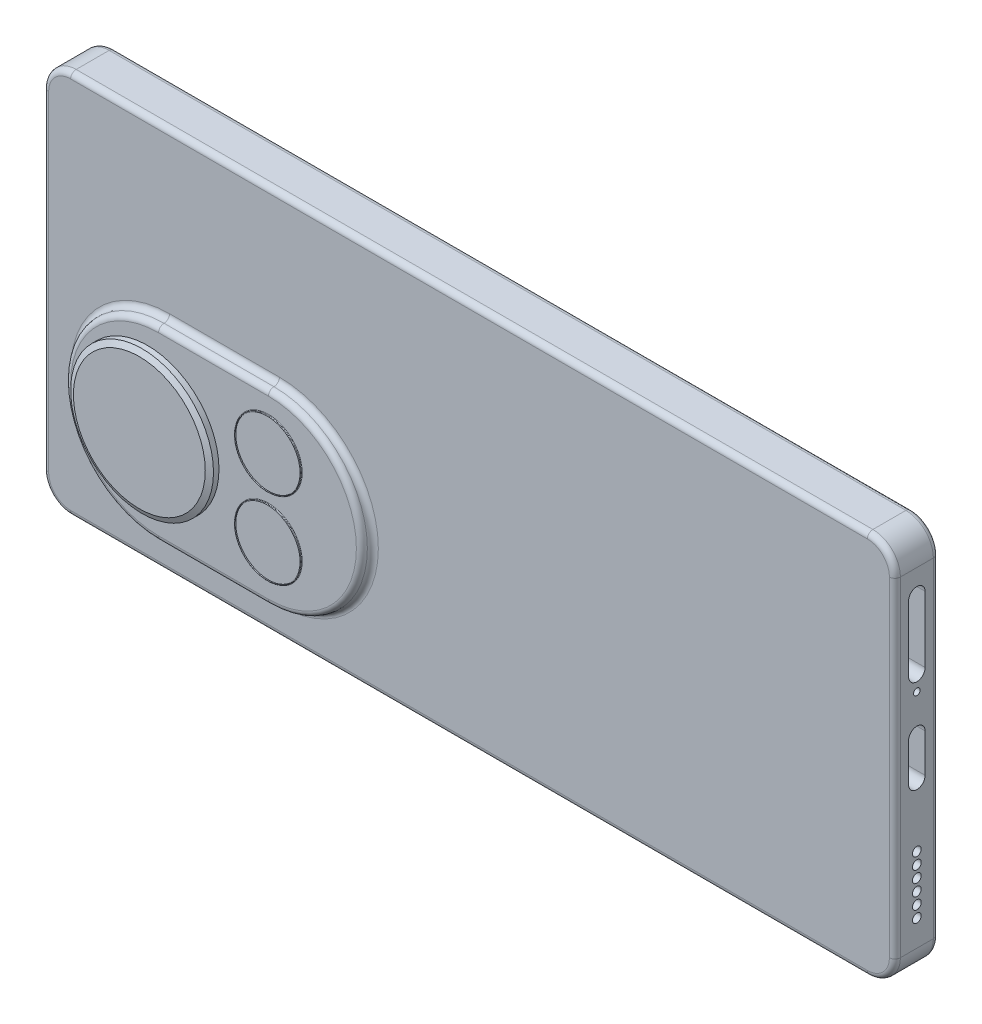
from build123d import *

# Parameters (mm, degrees)
EXTRUDE_1_DEPTH      = 8
FILLET_1_R           = 1
FILLET_2_R           = 1
CUT_EXTRUDE_2_DEPTH  = 7
EXTRUDE_3_DEPTH      = 4
CUT_EXTRUDE_3_DEPTH  = 15
SKETCH_8_R           = 0.6
CUT_EXTRUDE_5_DEPTH  = 10
SKETCH_10_R          = 0.95
CUT_EXTRUDE_6_DEPTH  = 10
SKETCH_11_R          = 0.85
CUT_EXTRUDE_7_DEPTH  = 10
SKETCH_12_R          = 0.95
SKETCH_12_R_2        = 0.9
EXTRUDE_4_DEPTH      = 10
EXTRUDE_START        = 10
SKETCH_13_R          = 0.85
EXTRUDE_5_DEPTH      = 10
SKETCH_14_R          = 0.9
CUT_EXTRUDE_8_DEPTH  = 10
SKETCH_15_R          = 0.9
SKETCH_15_R_2        = 0.8
EXTRUDE_6_DEPTH      = 10
SKETCH_16_R          = 0.9
SKETCH_16_R_2        = 0.8
EXTRUDE_7_DEPTH      = 10
SKETCH_17_R          = 0.8
EXTRUDE_8_DEPTH      = 10
SKETCH_18_R          = 0.8
EXTRUDE_9_DEPTH      = 10
SKETCH_19_R          = 0.8
CUT_EXTRUDE_9_DEPTH  = 10
SKETCH_20_R          = 0.8
CUT_EXTRUDE_10_DEPTH = 10
SKETCH_21_R          = 0.8
CUT_EXTRUDE_11_DEPTH = 10
SKETCH_22_R          = 0.8
CUT_EXTRUDE_12_DEPTH = 10
SKETCH_23_R          = 0.8
CUT_EXTRUDE_13_DEPTH = 10
SKETCH_24_R          = 0.8
CUT_EXTRUDE_14_DEPTH = 10
CUT_EXTRUDE_15_DEPTH = 1
CUT_EXTRUDE_16_DEPTH = 1
CUT_EXTRUDE_17_DEPTH = 128
CUT_EXTRUDE_18_DEPTH = 128
EXTRUDE_10_DEPTH     = 69
EXTRUDE_12_DEPTH     = 69
SKETCH_34_R          = 0.8
CUT_EXTRUDE_19_DEPTH = 190
EXTRUDE_START_2      = -10
SKETCH_37_R          = 0.8
SKETCH_37_R_2        = 0.6
EXTRUDE_13_DEPTH     = 10
EXTRUDE_START_3      = 135
SKETCH_39_R          = 0.8
EXTRUDE_14_DEPTH     = 135
SKETCH_40_R          = 0.6
CUT_EXTRUDE_20_DEPTH = 155
SKETCH_43_R          = 0.6
EXTRUDE_15_DEPTH     = 145
SKETCH_44_R          = 0.6
CUT_EXTRUDE_21_DEPTH = 10
SKETCH_45_R          = 0.6
CUT_EXTRUDE_22_DEPTH = 10
SKETCH_47_R          = 1
EXTRUDE_16_DEPTH     = 10
CUT_EXTRUDE_START    = -10
SKETCH_49_R          = 1
CUT_EXTRUDE_23_DEPTH = 10
SKETCH_50_R          = 1
EXTRUDE_17_DEPTH     = 10
EXTRUDE_18_DEPTH     = 2
FILLET_3_R           = 1
FILLET_4_R           = 1
SKETCH_54_R          = 13
EXTRUDE_19_DEPTH     = 1
SKETCH_55_R          = 12
EXTRUDE_20_DEPTH     = 0.5
SKETCH_56_R          = 1
CUT_EXTRUDE_24_DEPTH = 10
SKETCH_57_R          = 6.05
SKETCH_57_R_2        = 5.95
EXTRUDE_21_DEPTH     = 0.2
FILLET_6_R           = 0.1
SKETCH_58_R          = 6.05
SKETCH_58_R_2        = 5.95
EXTRUDE_22_DEPTH     = 0.2
FILLET_9_R           = 0.1
SKETCH_61_R          = 0.6
EXTRUDE_23_DEPTH     = 10
SKETCH_62_R          = 0.6
EXTRUDE_24_DEPTH     = 10
EXTRUDE_START_4      = -20
SKETCH_65_R          = 0.6
EXTRUDE_28_DEPTH     = 20
SKETCH_67_R          = 0.6
CUT_EXTRUDE_26_DEPTH = 10
SKETCH_68_R          = 0.6
CUT_EXTRUDE_27_DEPTH = 10
SKETCH_69_R          = 0.6
CUT_EXTRUDE_28_DEPTH = 10


with BuildPart() as part:
    # 草图1 → 凸台-拉伸1 (new body)
    with BuildSketch(Plane.XY):
        with BuildLine():
            Line((-74.7920434, 32.978558835), (-74.7920434, -27.021441165))
            ThreePointArc((-74.7920434, -27.021441165), (-73.327577306, -30.556975071), (-69.7920434, -32.021441165))
            Line((-69.7920434, -32.021441165), (75.2079566, -32.021441165))
            ThreePointArc((75.2079566, -32.021441165), (78.743490506, -30.556975071), (80.2079566, -27.021441165))
            Line((80.2079566, -27.021441165), (80.2079566, 32.978558835))
            ThreePointArc((80.2079566, 32.978558835), (78.743490506, 36.514092741), (75.2079566, 37.978558835))
            Line((75.2079566, 37.978558835), (-69.7920434, 37.978558835))
            ThreePointArc((-69.7920434, 37.978558835), (-73.327577306, 36.514092741), (-74.7920434, 32.978558835))
        make_face()
    extrude(amount=EXTRUDE_1_DEPTH)

    # 圆角1
    fillet_1_edges = [part.edges().sort_by_distance(p)[0] for p in [
        (-73.327577306, -30.556975071, 8),
        (2.7079566, -32.021441165, 8),
        (78.743490506, -30.556975071, 8),
        (80.2079566, 2.978558835, 8),
        (78.743490506, 36.514092741, 8),
        (2.7079566, 37.978558835, 8),
        (-73.327577306, 36.514092741, 8),
        (-74.7920434, 2.978558835, 8),
    ]]
    fillet(fillet_1_edges, radius=FILLET_1_R)

    # 圆角2
    fillet_2_edges = [part.edges().sort_by_distance(p)[0] for p in [
        (2.7079566, -32.021441165, 0),
        (-73.327577306, -30.556975071, 0),
        (-74.7920434, 2.978558835, 0),
        (-73.327577306, 36.514092741, 0),
        (2.7079566, 37.978558835, 0),
        (78.743490506, 36.514092741, 0),
        (80.2079566, 2.978558835, 0),
        (78.743490506, -30.556975071, 0),
    ]]
    fillet(fillet_2_edges, radius=FILLET_2_R)

    # 草图3 → 切除-拉伸2 (cut)
    with BuildSketch(Plane(origin=(80.2079566, 0, 0), x_dir=(0, 0, -1), z_dir=(1, 0, 0))):
        with BuildLine():
            Line((-5.5, -0.521441165), (-5.5, 6.478558835))
            ThreePointArc((-5.5, 6.478558835), (-4, 7.978558835), (-2.5, 6.478558835))
            Line((-2.5, 6.478558835), (-2.5, -0.521441165))
            ThreePointArc((-2.5, -0.521441165), (-4, -2.021441165), (-5.5, -0.521441165))
        make_face()
    extrude(amount=-CUT_EXTRUDE_2_DEPTH, mode=Mode.SUBTRACT)

    # 草图6 → 凸台-拉伸3 (add)
    with BuildSketch(Plane(origin=(73.2079566, 0, 0), x_dir=(0, 0, -1), z_dir=(1, 0, 0))):
        with BuildLine():
            Line((-4.1, 0.478558835), (-4.1, 5.478558835))
            ThreePointArc((-4.1, 5.478558835), (-4, 5.578558835), (-3.9, 5.478558835))
            Line((-3.9, 5.478558835), (-3.9, 0.478558835))
            ThreePointArc((-3.9, 0.478558835), (-4, 0.378558835), (-4.1, 0.478558835))
        make_face()
    extrude(amount=EXTRUDE_3_DEPTH)

    # 草图7 → 切除-拉伸3 (cut)
    with BuildSketch(Plane(origin=(80.2079566, 0, 0), x_dir=(0, 0, -1), z_dir=(1, 0, 0))):
        with BuildLine():
            Line((-5.5, 28.478558835), (-5.5, 16.478558835))
            ThreePointArc((-5.5, 16.478558835), (-4, 14.978558835), (-2.5, 16.478558835))
            Line((-2.5, 16.478558835), (-2.5, 28.478558835))
            ThreePointArc((-2.5, 28.478558835), (-4, 29.978558835), (-5.5, 28.478558835))
        make_face()
    extrude(amount=-CUT_EXTRUDE_3_DEPTH, mode=Mode.SUBTRACT)

    # 草图8 → 切除-拉伸5 (cut)
    with BuildSketch(Plane(origin=(80.2079566, 0, 0), x_dir=(0, 0, -1), z_dir=(1, 0, 0))):
        with Locations(Location((-4, 13.378558835, 0), (0, 0, 90))):
            Circle(SKETCH_8_R)
    extrude(amount=-CUT_EXTRUDE_5_DEPTH, mode=Mode.SUBTRACT)

    # 草图10 → 切除-拉伸6 (cut)
    with BuildSketch(Plane(origin=(80.2079566, 0, 0), x_dir=(0, 0, -1), z_dir=(1, 0, 0))):
        with Locations(Location((-4, -11.971441165, 0), (0, 0, 90))):
            Circle(SKETCH_10_R)
    extrude(amount=-CUT_EXTRUDE_6_DEPTH, mode=Mode.SUBTRACT)

    # 草图11 → 切除-拉伸7 (cut)
    with BuildSketch(Plane(origin=(80.2079566, 0, 0), x_dir=(0, 0, -1), z_dir=(1, 0, 0))):
        with Locations(Location((-4, -13.891441165, 0), (0, 0, 90))):
            Circle(SKETCH_11_R)
    extrude(amount=-CUT_EXTRUDE_7_DEPTH, mode=Mode.SUBTRACT)

    # 草图12 → 凸台-拉伸4 (add)
    with BuildSketch(Plane(origin=(80.2079566, 0, 0), x_dir=(0, 0, -1), z_dir=(1, 0, 0))):
        with Locations((-4, -11.971441165)):
            Circle(SKETCH_12_R)
        with Locations(Location((-4, -11.971441165, 0), (0, 0, 90))):
            Circle(SKETCH_12_R_2, mode=Mode.SUBTRACT)
    extrude(amount=-EXTRUDE_4_DEPTH)

    # 草图13 → 凸台-拉伸5 (add)
    with BuildSketch(Plane(origin=(70.2079566, 0, 0), x_dir=(0, 0, -1), z_dir=(1, 0, 0)).offset(EXTRUDE_START)):
        with Locations((-4, -13.891441165)):
            Circle(SKETCH_13_R)
    extrude(amount=-EXTRUDE_5_DEPTH)

    # 草图14 → 切除-拉伸8 (cut)
    with BuildSketch(Plane(origin=(80.2079566, 0, 0), x_dir=(0, 0, -1), z_dir=(1, 0, 0))):
        with Locations(Location((-4, -13.991441165, 0), (0, 0, 90))):
            Circle(SKETCH_14_R)
    extrude(amount=-CUT_EXTRUDE_8_DEPTH, mode=Mode.SUBTRACT)

    # 草图15 → 凸台-拉伸6 (add)
    with BuildSketch(Plane(origin=(80.2079566, 0, 0), x_dir=(0, 0, -1), z_dir=(1, 0, 0))):
        with Locations((-4, -11.971441165)):
            Circle(SKETCH_15_R)
        with Locations(Location((-4, -11.971441165, 0), (0, 0, 90))):
            Circle(SKETCH_15_R_2, mode=Mode.SUBTRACT)
    extrude(amount=-EXTRUDE_6_DEPTH)

    # 草图16 → 凸台-拉伸7 (add)
    with BuildSketch(Plane(origin=(70.2079566, 0, 0), x_dir=(0, 0, -1), z_dir=(1, 0, 0)).offset(EXTRUDE_START)):
        with Locations((-4, -13.991441165)):
            Circle(SKETCH_16_R)
        with Locations(Location((-4, -13.991441165, 0), (0, 0, 90))):
            Circle(SKETCH_16_R_2, mode=Mode.SUBTRACT)
    extrude(amount=-EXTRUDE_7_DEPTH)

    # 草图17 → 凸台-拉伸8 (add)
    with BuildSketch(Plane(origin=(70.2079566, 0, 0), x_dir=(0, 0, -1), z_dir=(1, 0, 0)).offset(EXTRUDE_START)):
        with Locations((-4, -11.971441165)):
            Circle(SKETCH_17_R)
    extrude(amount=-EXTRUDE_8_DEPTH)

    # 草图18 → 凸台-拉伸9 (add)
    with BuildSketch(Plane(origin=(70.2079566, 0, 0), x_dir=(0, 0, -1), z_dir=(1, 0, 0)).offset(EXTRUDE_START)):
        with Locations((-4, -13.991441165)):
            Circle(SKETCH_18_R)
    extrude(amount=-EXTRUDE_9_DEPTH)

    # 草图19 → 切除-拉伸9 (cut)
    with BuildSketch(Plane(origin=(80.2079566, 0, 0), x_dir=(0, 0, -1), z_dir=(1, 0, 0))):
        with Locations(Location((-4, -11.771441165, 0), (0, 0, 90))):
            Circle(SKETCH_19_R)
    extrude(amount=-CUT_EXTRUDE_9_DEPTH, mode=Mode.SUBTRACT)

    # 草图20 → 切除-拉伸10 (cut)
    with BuildSketch(Plane(origin=(80.2079566, 0, 0), x_dir=(0, 0, -1), z_dir=(1, 0, 0))):
        with Locations(Location((-4, -13.871441165, 0), (0, 0, 90))):
            Circle(SKETCH_20_R)
    extrude(amount=-CUT_EXTRUDE_10_DEPTH, mode=Mode.SUBTRACT)

    # 草图21 → 切除-拉伸11 (cut)
    with BuildSketch(Plane(origin=(80.2079566, 0, 0), x_dir=(0, 0, -1), z_dir=(1, 0, 0))):
        with Locations(Location((-4, -15.971441165, 0), (0, 0, 90))):
            Circle(SKETCH_21_R)
    extrude(amount=-CUT_EXTRUDE_11_DEPTH, mode=Mode.SUBTRACT)

    # 草图22 → 切除-拉伸12 (cut)
    with BuildSketch(Plane(origin=(80.2079566, 0, 0), x_dir=(0, 0, -1), z_dir=(1, 0, 0))):
        with Locations(Location((-4, -18.071441165, 0), (0, 0, 90))):
            Circle(SKETCH_22_R)
    extrude(amount=-CUT_EXTRUDE_12_DEPTH, mode=Mode.SUBTRACT)

    # 草图23 → 切除-拉伸13 (cut)
    with BuildSketch(Plane(origin=(80.2079566, 0, 0), x_dir=(0, 0, -1), z_dir=(1, 0, 0))):
        with Locations(Location((-4, -20.171441165, 0), (0, 0, 90))):
            Circle(SKETCH_23_R)
    extrude(amount=-CUT_EXTRUDE_13_DEPTH, mode=Mode.SUBTRACT)

    # 草图24 → 切除-拉伸14 (cut)
    with BuildSketch(Plane(origin=(80.2079566, 0, 0), x_dir=(0, 0, -1), z_dir=(1, 0, 0))):
        with Locations(Location((-4, -22.271441165, 0), (0, 0, 90))):
            Circle(SKETCH_24_R)
    extrude(amount=-CUT_EXTRUDE_14_DEPTH, mode=Mode.SUBTRACT)

    # 草图25 → 切除-拉伸15 (cut)
    with BuildSketch(Plane(origin=(0, 37.978558835, 0), x_dir=(1, 0, 0), z_dir=(0, 1, 0))):
        with BuildLine():
            Line((-14.7920434, -5), (-31.7920434, -5))
            ThreePointArc((-31.7920434, -5), (-32.7920434, -4), (-31.7920434, -3))
            Line((-31.7920434, -3), (-14.7920434, -3))
            ThreePointArc((-14.7920434, -3), (-13.7920434, -4), (-14.7920434, -5))
        make_face()
    extrude(amount=-CUT_EXTRUDE_15_DEPTH, mode=Mode.SUBTRACT)

    # 草图26 → 切除-拉伸16 (cut)
    with BuildSketch(Plane(origin=(0, 37.978558835, 0), x_dir=(1, 0, 0), z_dir=(0, 1, 0))):
        with BuildLine():
            Line((-6.7920434, -5), (0.2079566, -5))
            ThreePointArc((0.2079566, -5), (1.2079566, -4), (0.2079566, -3))
            Line((0.2079566, -3), (-6.7920434, -3))
            ThreePointArc((-6.7920434, -3), (-7.7920434, -4), (-6.7920434, -5))
        make_face()
    extrude(amount=-CUT_EXTRUDE_16_DEPTH, mode=Mode.SUBTRACT)

    # 草图28 → 切除-拉伸17 (cut)
    with BuildSketch(Plane(origin=(0, 37.978558835, 0), x_dir=(1, 0, 0), z_dir=(0, 1, 0))):
        with BuildLine():
            Line((-31.7920434, -3), (-14.7920434, -3))
            ThreePointArc((-14.7920434, -3), (-13.7920434, -4), (-14.7920434, -5))
            Line((-14.7920434, -5), (-31.7920434, -5))
            ThreePointArc((-31.7920434, -5), (-32.7920434, -4), (-31.7920434, -3))
        make_face()
    extrude(amount=-CUT_EXTRUDE_17_DEPTH, mode=Mode.SUBTRACT)

    # 草图30 → 切除-拉伸18 (cut)
    with BuildSketch(Plane(origin=(0, 37.978558835, 0), x_dir=(1, 0, 0), z_dir=(0, 1, 0))):
        with BuildLine():
            Line((-6.7920434, -3), (0.2079566, -3))
            ThreePointArc((0.2079566, -3), (1.2079566, -4), (0.2079566, -5))
            Line((0.2079566, -5), (-6.7920434, -5))
            ThreePointArc((-6.7920434, -5), (-7.7920434, -4), (-6.7920434, -3))
        make_face()
    extrude(amount=-CUT_EXTRUDE_18_DEPTH, mode=Mode.SUBTRACT)

    # 草图32 → 凸台-拉伸10 (add)
    with BuildSketch(Plane(origin=(0, 37.978558835, 0), x_dir=(1, 0, 0), z_dir=(0, 1, 0))):
        with BuildLine():
            Line((-31.7920434, -3), (-14.7920434, -3))
            ThreePointArc((-14.7920434, -3), (-13.7920434, -4), (-14.7920434, -5))
            Line((-14.7920434, -5), (-31.7920434, -5))
            ThreePointArc((-31.7920434, -5), (-32.7920434, -4), (-31.7920434, -3))
        make_face()
    extrude(amount=-EXTRUDE_10_DEPTH)

    # 草图33 → 凸台-拉伸12 (add)
    with BuildSketch(Plane(origin=(0, 37.978558835, 0), x_dir=(1, 0, 0), z_dir=(0, 1, 0))):
        with BuildLine():
            Line((-6.7920434, -3), (0.2079566, -3))
            ThreePointArc((0.2079566, -3), (1.2079566, -4), (0.2079566, -5))
            Line((0.2079566, -5), (-6.7920434, -5))
            ThreePointArc((-6.7920434, -5), (-7.7920434, -4), (-6.7920434, -3))
        make_face()
    extrude(amount=-EXTRUDE_12_DEPTH)

    # 草图34 → 切除-拉伸19 (cut)
    with BuildSketch(Plane(origin=(80.2079566, 0, 0), x_dir=(0, 0, -1), z_dir=(1, 0, 0))):
        with Locations(Location((-4, -22.271441165, 0), (0, 0, 90))):
            Circle(SKETCH_34_R)
    extrude(amount=-CUT_EXTRUDE_19_DEPTH, mode=Mode.SUBTRACT)

    # 草图37 → 凸台-拉伸13 (add)
    with BuildSketch(Plane.ZY.offset(74.7920434).offset(EXTRUDE_START_2)):
        with Locations(Location((4, -22.271441165, 0), (0, 0, 90))):
            Circle(SKETCH_37_R)
        with Locations(Location((4, -22.271441165, 0), (0, 0, 270))):
            Circle(SKETCH_37_R_2, mode=Mode.SUBTRACT)
    extrude(amount=EXTRUDE_13_DEPTH)

    # 草图39 → 凸台-拉伸14 (add)
    with BuildSketch(Plane(origin=(-64.7920434, 0, 0), x_dir=(0, 0, -1), z_dir=(1, 0, 0)).offset(EXTRUDE_START_3)):
        with Locations(Location((-4, -22.271441165, 0), (0, 0, 90))):
            Circle(SKETCH_39_R)
    extrude(amount=-EXTRUDE_14_DEPTH)

    # 草图40 → 切除-拉伸20 (cut)
    with BuildSketch(Plane(origin=(73.2079566, 0, 0), x_dir=(0, 0, -1), z_dir=(1, 0, 0))):
        with Locations(Location((-4, 0.478558835, 0), (0, 0, 90))):
            Circle(SKETCH_40_R)
    extrude(amount=-CUT_EXTRUDE_20_DEPTH, mode=Mode.SUBTRACT)

    # 草图43 → 凸台-拉伸15 (add)
    with BuildSketch(Plane.ZY.offset(-73.2079566)):
        with Locations(Location((4, 0.478558835, 0), (0, 0, 90))):
            Circle(SKETCH_43_R)
    extrude(amount=EXTRUDE_15_DEPTH)

    # 草图44 → 切除-拉伸21 (cut)
    with BuildSketch(Plane.ZY.offset(74.7920434)):
        with Locations(Location((4, 2.678558835, 0), (0, 0, 270))):
            Circle(SKETCH_44_R)
    extrude(amount=-CUT_EXTRUDE_21_DEPTH, mode=Mode.SUBTRACT)

    # 草图45 → 切除-拉伸22 (cut)
    with BuildSketch(Plane.ZY.offset(74.7920434)):
        with Locations(Location((4, 4.878558835, 0), (0, 0, 270))):
            Circle(SKETCH_45_R)
    extrude(amount=-CUT_EXTRUDE_22_DEPTH, mode=Mode.SUBTRACT)

    # 草图50 → 凸台-拉伸17 (add)
    with BuildSketch(Plane.XZ.offset(31.021441165)):
        with Locations(Location((-31.7920434, 4, 0), (0, 0, 90))):
            Circle(SKETCH_50_R)
    extrude(amount=EXTRUDE_17_DEPTH)

    # 草图53 → 凸台-拉伸18 (add)
    with BuildSketch(Plane.XY.offset(8)):
        with BuildLine():
            Line((-31.7920434, -26.021441165), (-51.7920434, -26.021441165))
            ThreePointArc((-51.7920434, -26.021441165), (-68.7920434, -9.021441165), (-51.7920434, 7.978558835))
            Line((-51.7920434, 7.978558835), (-31.7920434, 7.978558835))
            ThreePointArc((-31.7920434, 7.978558835), (-14.7920434, -9.021441165), (-31.7920434, -26.021441165))
        make_face()
    extrude(amount=EXTRUDE_18_DEPTH)

    # 圆角3
    fillet_3_edges = [part.edges().sort_by_distance(p)[0] for p in [
        (-14.7920434, -9.021441165, 8),
        (-41.7920434, 7.978558835, 8),
        (-68.7920434, -9.021441165, 8),
        (-41.7920434, -26.021441165, 8),
    ]]
    fillet(fillet_3_edges, radius=FILLET_3_R)

    # 圆角4
    fillet_4_edges = [part.edges().sort_by_distance(p)[0] for p in [
        (-41.7920434, -26.021441165, 10),
        (-68.7920434, -9.021441165, 10),
        (-41.7920434, 7.978558835, 10),
        (-14.7920434, -9.021441165, 10),
    ]]
    fillet(fillet_4_edges, radius=FILLET_4_R - 0.0001)  # a hair under: the kernel refuses the full size

    # 草图54 → 凸台-拉伸19 (add)
    with BuildSketch(Plane.XY.offset(10)):
        with Locations((-53.7920434, -9.021441165)):
            Circle(SKETCH_54_R)
    extrude(amount=EXTRUDE_19_DEPTH)

    # 草图55 → 凸台-拉伸20 (add)
    with BuildSketch(Plane.XY.offset(11)):
        with Locations((-53.7920434, -9.021441165)):
            Circle(SKETCH_55_R)
    extrude(amount=EXTRUDE_20_DEPTH)

    # loft up to a face of the part (loft_1)
    loft([Face(Wire([part.edges().sort_by_distance((-62.006608671, -0.273817636, 11.5))[0]])), Face(Wire([part.edges().sort_by_distance((-62.691155777, 0.455150992, 11))[0]]))])

    # 草图56 → 切除-拉伸24 (cut)
    with BuildSketch(Plane.XZ.offset(41.021441165).offset(CUT_EXTRUDE_START)):
        with Locations((-31.7920434, 4)):
            Circle(SKETCH_56_R)
    extrude(amount=CUT_EXTRUDE_24_DEPTH, mode=Mode.SUBTRACT)

    # 草图57 → 凸台-拉伸21 (add)
    with BuildSketch(Plane.XY.offset(10)):
        with Locations((-31.7920434, -16.021441165)):
            Circle(SKETCH_57_R)
        with Locations((-31.7920434, -16.021441165)):
            Circle(SKETCH_57_R_2, mode=Mode.SUBTRACT)
    extrude(amount=EXTRUDE_21_DEPTH)

    # 圆角6
    fillet_6_edges = [part.edges().sort_by_distance(p)[0] for p in [
        (-37.8420434, -16.021441165, 10.2),
        (-37.8420434, -16.021441165, 10),
    ]]
    fillet(fillet_6_edges, radius=FILLET_6_R - 0.0001)  # a hair under: the kernel refuses the full size

    # 草图58 → 凸台-拉伸22 (add)
    with BuildSketch(Plane.XY.offset(10)):
        with Locations((-31.7920434, -2.021441165)):
            Circle(SKETCH_58_R)
        with Locations((-31.7920434, -2.021441165)):
            Circle(SKETCH_58_R_2, mode=Mode.SUBTRACT)
    extrude(amount=EXTRUDE_22_DEPTH)

    # 圆角9
    fillet_9_edges = [part.edges().sort_by_distance(p)[0] for p in [
        (-37.8420434, -2.021441165, 10.2),
        (-37.8420434, -2.021441165, 10),
    ]]
    fillet(fillet_9_edges, radius=FILLET_9_R - 0.0001)  # a hair under: the kernel refuses the full size

    # 草图61 → 凸台-拉伸23 (add)
    with BuildSketch(Plane.ZY.offset(64.7920434).offset(EXTRUDE_START)):
        with Locations((4, 4.878558835)):
            Circle(SKETCH_61_R)
    extrude(amount=-EXTRUDE_23_DEPTH)

    # 草图62 → 凸台-拉伸24 (add)
    with BuildSketch(Plane.ZY.offset(64.7920434).offset(EXTRUDE_START)):
        with Locations((4, 2.678558835)):
            Circle(SKETCH_62_R)
    extrude(amount=-EXTRUDE_24_DEPTH)

    # 草图65 → 凸台-拉伸28 (add)
    with BuildSketch(Plane.ZY.offset(74.7920434).offset(EXTRUDE_START_4)):
        with Locations((4, 0.478558835)):
            Circle(SKETCH_65_R)
    extrude(amount=EXTRUDE_28_DEPTH)

    # 草图67 → 切除-拉伸26 (cut)
    with BuildSketch(Plane.ZY.offset(74.7920434)):
        with Locations(Location((4, 9.578558835, 0), (0, 0, 270))):
            Circle(SKETCH_67_R)
    extrude(amount=-CUT_EXTRUDE_26_DEPTH, mode=Mode.SUBTRACT)

    # 草图68 → 切除-拉伸27 (cut)
    with BuildSketch(Plane.ZY.offset(74.7920434)):
        with Locations(Location((4, 11.778558835, 0), (0, 0, 270))):
            Circle(SKETCH_68_R)
    extrude(amount=-CUT_EXTRUDE_27_DEPTH, mode=Mode.SUBTRACT)

    # 草图69 → 切除-拉伸28 (cut)
    with BuildSketch(Plane.ZY.offset(74.7920434)):
        with Locations(Location((4, 13.978558835, 0), (0, 0, 270))):
            Circle(SKETCH_69_R)
    extrude(amount=-CUT_EXTRUDE_28_DEPTH, mode=Mode.SUBTRACT)


with BuildPart() as body_2:
    # 草图47 → 凸台-拉伸16 (new body)
    with BuildSketch(Plane.XZ.offset(32.021441165)):
        with Locations(Location((-14.7920434, 4, 0), (0, 0, 270))):
            Circle(SKETCH_47_R)
    extrude(amount=EXTRUDE_16_DEPTH)

    # 草图49 → 切除-拉伸23 (cut)
    with BuildSketch(Plane.XZ.offset(42.021441165).offset(CUT_EXTRUDE_START)):
        with Locations((-14.7920434, 4)):
            Circle(SKETCH_49_R)
    extrude(amount=CUT_EXTRUDE_23_DEPTH, mode=Mode.SUBTRACT)


solid = part.part
